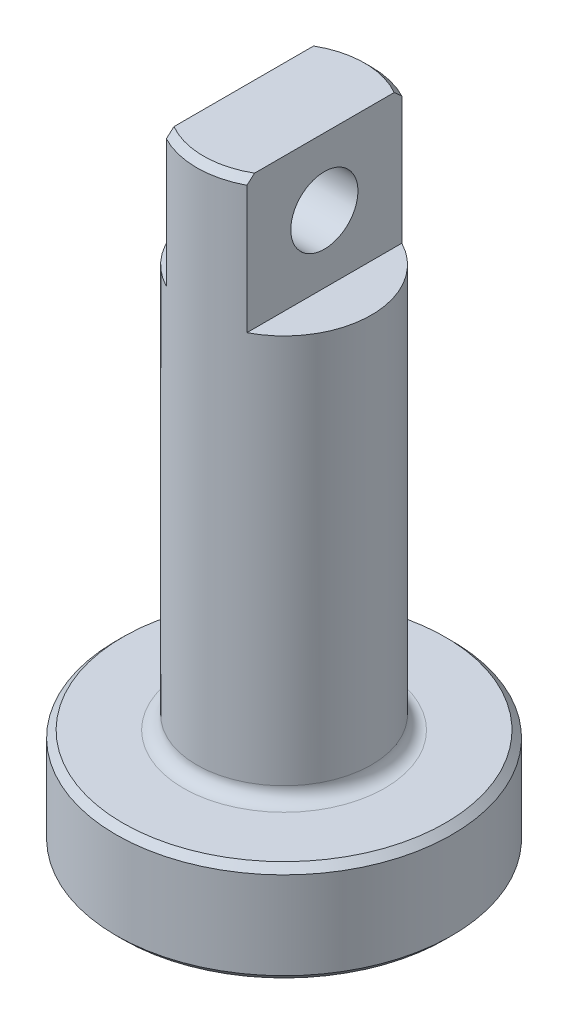
from build123d import *

# Parameters (mm, degrees)
SZKIC2_R                    = 25
DODANIE_WYCI_GNI_CIE1_DEPTH = 15
SZKIC3_R                    = 13
DODANIE_WYCI_GNI_CIE2_DEPTH = 80
CHAMFER2_SIZE               = 1
CHAMFER3_SIZE               = 1
FILLET1_R                   = 2
CUT_EXTRUDE1_DEPTH          = 20
SKETCH4_R                   = 5
CUT_EXTRUDE3_DEPTH          = 12


with BuildPart() as part:
    # Szkic2 → Dodanie-wyciągnięcie1 (new body)
    with BuildSketch(Plane(origin=(0, 0, 0), x_dir=(1, 0, 0), z_dir=(0, 1, 0))):
        with Locations(Location((0, 0, 0), (0, 0, 270))):
            Circle(SZKIC2_R)
    extrude(amount=DODANIE_WYCI_GNI_CIE1_DEPTH)

    # Szkic3 → Dodanie-wyciągnięcie2 (add)
    with BuildSketch(Plane(origin=(0, 15, 0), x_dir=(1, 0, 0), z_dir=(0, 1, 0))):
        with Locations(Location((0, 0, 0), (0, 0, 270))):
            Circle(SZKIC3_R)
    extrude(amount=DODANIE_WYCI_GNI_CIE2_DEPTH)

    # Chamfer1: read off the stored shape, not the designer's step
    # Chamfer1 outline → Chamfer1 (revolve, cut)
    with BuildSketch(Plane.XY):
        Polygon((25, 15), (24, 15), (25, 14), align=None)
    revolve(axis=Axis((0, 0, 0), (0, 1, 0)), mode=Mode.SUBTRACT)

    # Chamfer2
    chamfer2_edges = [part.edges().sort_by_distance(p)[0] for p in [
        (0, 0, -25),
    ]]
    chamfer(chamfer2_edges, length=CHAMFER2_SIZE)

    # Chamfer3
    chamfer3_edges = [part.edges().sort_by_distance(p)[0] for p in [
        (0, 95, -13),
    ]]
    chamfer(chamfer3_edges, length=CHAMFER3_SIZE)

    # Fillet1
    fillet1_edges = [part.edges().sort_by_distance(p)[0] for p in [
        (0, 15, -13),
    ]]
    fillet(fillet1_edges, radius=FILLET1_R)

    # Sketch2 → Cut-Extrude1 (cut)
    with BuildSketch(Plane(origin=(0, 95, 0), x_dir=(1, 0, 0), z_dir=(0, 1, 0))):
        with BuildLine():
            Line((6, 11.993862748), (6, -11.993862748))
            ThreePointArc((6, -11.993862748), (13.41091882, 0), (6, 11.993862748))
        make_face()
        with BuildLine():
            Line((-6, -11.993862748), (-6, 11.993862748))
            ThreePointArc((-6, 11.993862748), (-13.41091882, 0), (-6, -11.993862748))
        make_face()
    extrude(amount=-CUT_EXTRUDE1_DEPTH, mode=Mode.SUBTRACT)

    # Sketch4 → Cut-Extrude3 (cut)
    with BuildSketch(Plane.ZY.offset(6)):
        with Locations((0, 85)):
            Circle(SKETCH4_R)
    extrude(amount=-CUT_EXTRUDE3_DEPTH, mode=Mode.SUBTRACT)


solid = part.part
